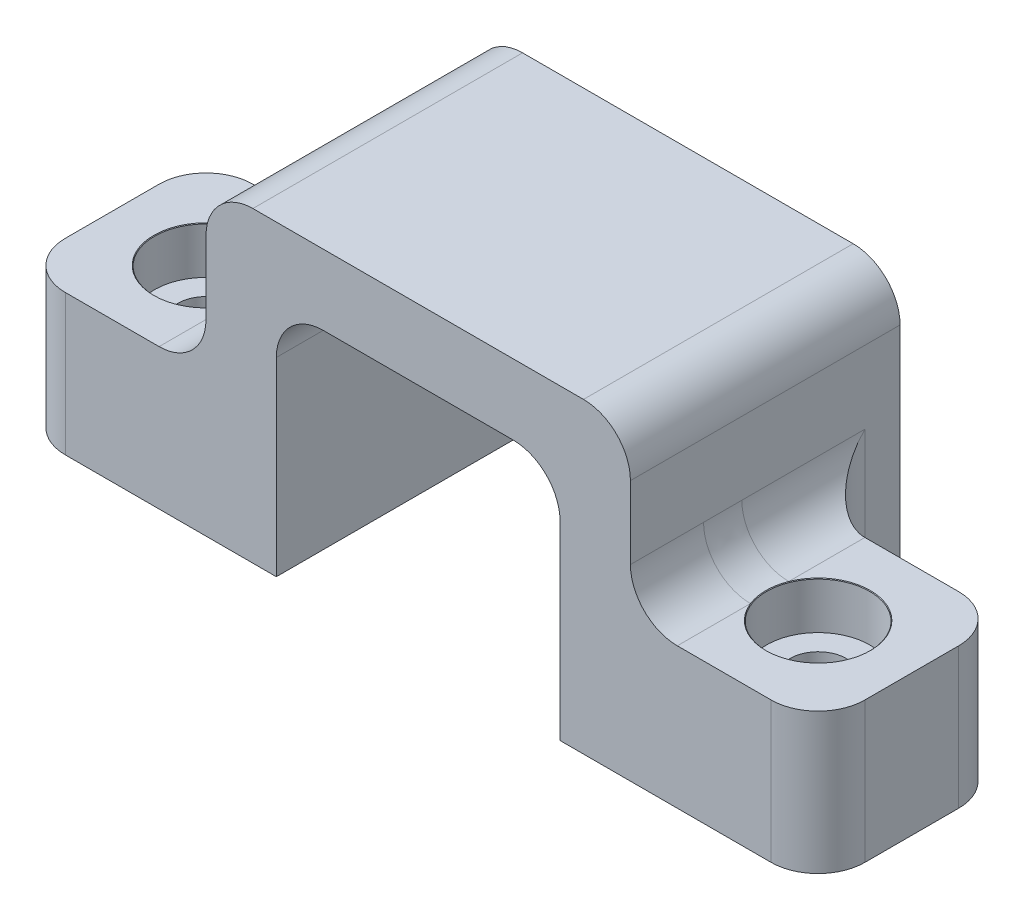
from build123d import *

# Parameters (mm, degrees)
BOSS_EXTRUDE1_DEPTH           = 11.5
SKETCH2_W                     = 8
SKETCH2_H                     = 6
BOSS_EXTRUDE2_DEPTH           = 8
CBORE_FOR_M2_SHCS1_AT_2_COUNT = 2
CBORE_FOR_M2_SHCS1_AT_2_PITCH = 26.169866967
FILLET1_R                     = 2


with BuildPart() as part:
    # Sketch1 → Boss-Extrude1 (new body)
    with BuildSketch(Plane.XY):
        Polygon((-9.05, 0), (-6.05, 0), (-6.05, 10.1), (6.05, 10.1), (6.05, 0), (9.05, 0), (9.05, 13.1), (-9.05, 13.1), align=None)
    extrude(amount=BOSS_EXTRUDE1_DEPTH)

    # Sketch2 → Boss-Extrude2 (add)
    with BuildSketch(Plane.XY.offset(11.5)):
        with Locations((-13.05, 3)):
            Rectangle(SKETCH2_W, SKETCH2_H)
        with Locations((13.05, 3)):
            Rectangle(SKETCH2_W, SKETCH2_H)
    extrude(amount=-BOSS_EXTRUDE2_DEPTH)

    # Sketch4 → CBORE for M2 SHCS1 (revolve, cut)
    with BuildSketch(Plane(origin=(-13.05, 6, 7.5), x_dir=(0, 0, 1), z_dir=(1, 0, 0))):
        Polygon((0, 0), (0, 6), (1.2, 6), (1.2, 2), (2.2, 2), (2.2, 0.025), (2.225, 0), align=None)
    cbore_for_m2_shcs1 = revolve(axis=Axis((-13.05, 12.35, 7.5), (0, -1, 0)), mode=Mode.SUBTRACT)

    # CBORE for M2 SHCS1 at 2: CBORE for M2 SHCS1 ×2
    with Locations(*[Vector(0.999996988951148, 0, 0.002453994424951137) * (i * CBORE_FOR_M2_SHCS1_AT_2_PITCH) for i in range(1, CBORE_FOR_M2_SHCS1_AT_2_COUNT)]):
        add(cbore_for_m2_shcs1, mode=Mode.SUBTRACT)

    # Fillet1
    fillet1_edges = [part.edges().sort_by_distance(p)[0] for p in [
        (-6.05, 10.1, 5.75),
        (6.05, 10.1, 5.75),
        (-9.05, 3, 3.5),
        (9.05, 3, 3.5),
        (17.05, 3, 3.5),
        (17.05, 3, 11.5),
        (9.05, 6, 7.5),
        (-17.05, 3, 3.5),
        (-17.05, 3, 11.5),
        (-9.05, 6, 7.5),
        (9.05, 13.1, 5.75),
        (-9.05, 13.1, 5.75),
    ]]
    fillet(fillet1_edges, radius=FILLET1_R)


solid = part.part
